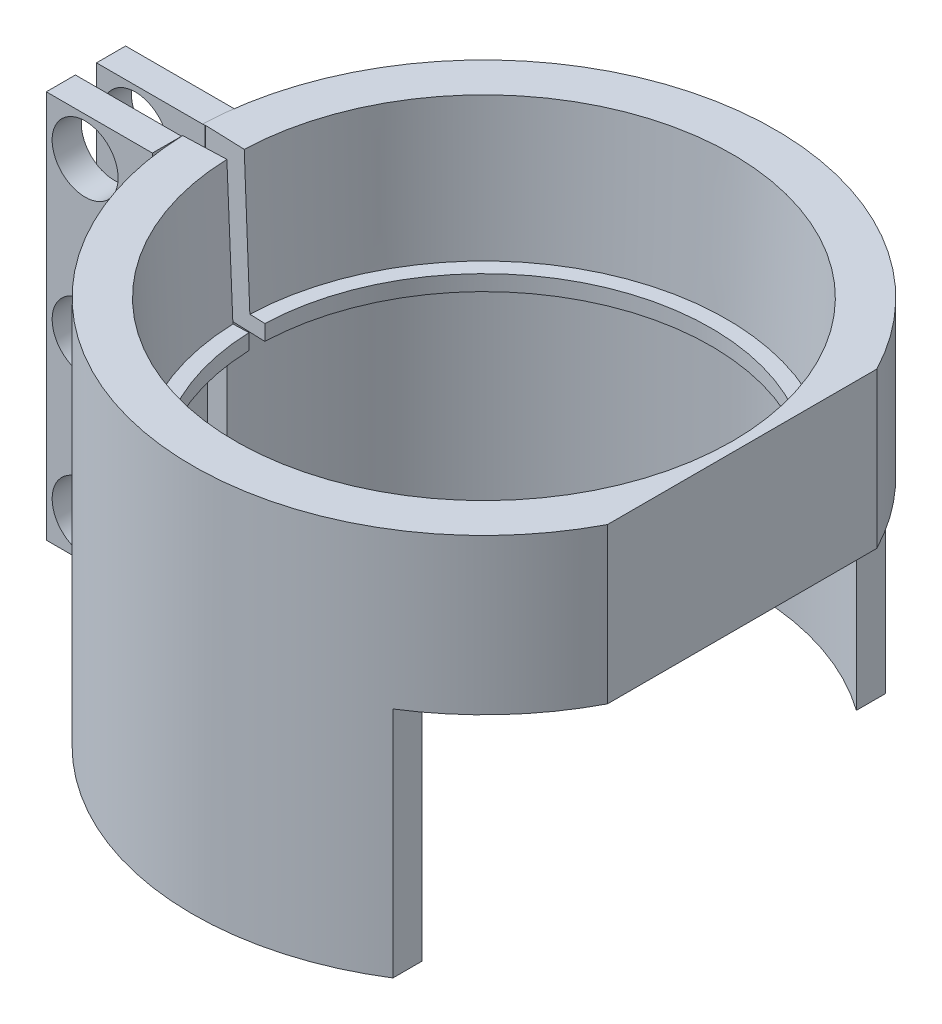
from build123d import *
from build123d.topology import SkipClean

# Parameters (mm, degrees)
BOSS_EXTRUDE1_DEPTH      = 12
REVOLVE1_ANGLE           = 268
REVOLVE1_OTHER_WAY_ANGLE = 88
CUT_EXTRUDE1_DEPTH       = 34.277843841
CUT_EXTRUDE1_DEPTH_BACK  = 34.277843841
SKETCH4_R                = 1.7
SKETCH5_W                = 5.464329862
SKETCH5_H                = 8
SKETCH5_R                = 1.7
BOSS_EXTRUDE3_DEPTH      = 1.5
SKETCH6_W                = 5.58912352
SKETCH6_H                = 8
SKETCH6_R                = 1.7
BOSS_EXTRUDE6_DEPTH      = 1.5
SKETCH7_W                = 13.395261238
SKETCH7_H                = 27.001129241
CUT_EXTRUDE2_DEPTH       = 12
SKETCH8_W                = 6.997667241
SKETCH8_H                = 27.404272266
CUT_EXTRUDE3_DEPTH       = 10


with BuildPart() as part:
    # Sketch1 → Boss-Extrude1 (new body)
    with BuildSketch(Plane(origin=(0, 0, 0), x_dir=(1, 0, 0), z_dir=(0, 1, 0))):
        with BuildLine():
            Line((-13.740839561, 0.501824818), (-14.997715427, 0.5))
            Line((-14.997715427, 0.5), (-20.455192267, 0.5))
            Line((-20.455192267, 0.5), (-20.455192267, 2))
            Line((-20.455192267, 2), (-14.866068747, 2))
            ThreePointArc((-14.866068747, 2), (-12.460231809, 8.351204898), (-7.5, 12.990381057))
            ThreePointArc((-7.5, 12.990381057), (15, 0), (-7.5, -12.990381057))
            ThreePointArc((-7.5, -12.990381057), (-12.436410154, -8.386638331), (-14.85444215, -2.084597902))
            Line((-14.85444215, -2.084597902), (-20.455192267, -2.084597902))
            Line((-20.455192267, -2.084597902), (-20.455192267, -0.5))
            Line((-20.455192267, -0.5), (-14.997715427, -0.5))
            Line((-14.997715427, -0.5), (-13.740839561, -0.501824818))
            ThreePointArc((-13.740839561, -0.501824818), (-11.780388739, -7.09118757), (-6.875, -11.907849302))
            ThreePointArc((-6.875, -11.907849302), (13.75, 0), (-6.875, 11.907849302))
            ThreePointArc((-6.875, 11.907849302), (-11.780388739, 7.09118757), (-13.740839561, 0.501824818))
        make_face()
    extrude(amount=BOSS_EXTRUDE1_DEPTH)

    # Sketch3 → Revolve1 (revolve)
    with BuildSketch(Plane(origin=(0, 0, 0), x_dir=(0, 0, -1), z_dir=(1, 0, 0))):
        Polygon((-15, 12), (-15, 20), (-12.8, 20), (-12.5, 12.8), (-11.7, 12.8), (-11.7, 12), (-12.2, 12), align=None)
    revolve(axis=Axis((0, 12, 0), (0, 1, 0)), revolution_arc=REVOLVE1_ANGLE)

    # Sketch3 → Revolve1 other way (revolve)
    with SkipClean():  # the faces are left unmerged after this step: merging them gives an invalid solid
        with BuildSketch(Plane(origin=(0, 0, 0), x_dir=(0, 0, -1), z_dir=(1, 0, 0))):
            Polygon((-15, 12), (-15, 20), (-12.8, 20), (-12.5, 12.8), (-11.7, 12.8), (-11.7, 12), (-12.2, 12), align=None)
        revolve(axis=Axis((0, 12, 0), (0, -1, 0)), revolution_arc=REVOLVE1_OTHER_WAY_ANGLE)
    add(part.part.scale(1), mode=Mode.REPLACE)  # the faces are merged on a copy

    # Sketch4 → Cut-Extrude1 (cut, two sides: drawn at the far end of the back side and taken through both)
    with BuildSketch(Plane(origin=(0, 0, -2), x_dir=(-1, 0, 0), z_dir=(0, 0, -1)).offset(-CUT_EXTRUDE1_DEPTH_BACK)):
        with Locations((18.455192267, 10)):
            Circle(SKETCH4_R)
        with Locations((18.455192267, 2)):
            Circle(SKETCH4_R)
    extrude(amount=CUT_EXTRUDE1_DEPTH + CUT_EXTRUDE1_DEPTH_BACK, mode=Mode.SUBTRACT)

    # Sketch5 → Boss-Extrude3 (add)
    with BuildSketch(Plane.XY.offset(2.084597902)):
        with Locations((-17.723027336, 16)):
            Rectangle(SKETCH5_W, SKETCH5_H)
        with Locations((-18.455192267, 18)):
            Circle(SKETCH5_R, mode=Mode.SUBTRACT)
    extrude(amount=-BOSS_EXTRUDE3_DEPTH)

    # Sketch7 → Cut-Extrude2 (cut)
    with BuildSketch(Plane.XZ):
        with Locations((14.697569852, -0.811948768)):
            Rectangle(SKETCH7_W, SKETCH7_H)
    extrude(amount=-CUT_EXTRUDE2_DEPTH, mode=Mode.SUBTRACT)

    # Sketch8 → Cut-Extrude3 (cut)
    with BuildSketch(Plane(origin=(0, 20, 0), x_dir=(1, 0, 0), z_dir=(0, 1, 0))):
        with Locations((16.798833621, 0.586396696)):
            Rectangle(SKETCH8_W, SKETCH8_H)
    extrude(amount=-CUT_EXTRUDE3_DEPTH, mode=Mode.SUBTRACT)


with BuildPart() as body_2:
    # Sketch6 → Boss-Extrude6 (new body)
    with BuildSketch(Plane(origin=(0, 0, -2), x_dir=(-1, 0, 0), z_dir=(0, 0, -1))):
        with Locations((17.660630507, 16)):
            Rectangle(SKETCH6_W, SKETCH6_H)
        with Locations((18.455192267, 18)):
            Circle(SKETCH6_R, mode=Mode.SUBTRACT)
    extrude(amount=-BOSS_EXTRUDE6_DEPTH)


solid = Compound([part.part, body_2.part])
